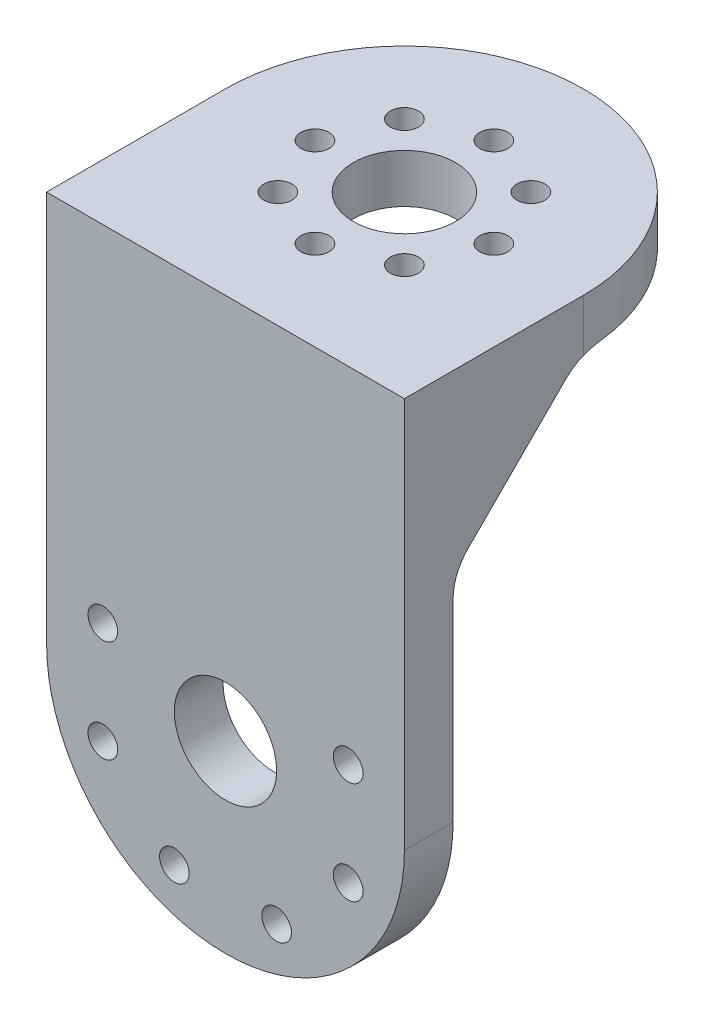
from build123d import *

# Parameters (mm, degrees)
SKETCH1_W                      = 70
SKETCH1_H                      = 70
BOSS_EXTRUDE1_DEPTH            = 9.525
CBORE_FOR_M5_SBHCS1_AT_2_COUNT = 2
CBORE_FOR_M5_SBHCS1_AT_2_PITCH = 13.393920133
CBORE_FOR_M5_SBHCS1_AT_3_COUNT = 2
CBORE_FOR_M5_SBHCS1_AT_3_PITCH = 24.748737342
CBORE_FOR_M5_SBHCS1_AT_4_COUNT = 2
CBORE_FOR_M5_SBHCS1_AT_4_PITCH = 32.335783638
CBORE_FOR_M5_SBHCS1_AT_5_COUNT = 2
CBORE_FOR_M5_SBHCS1_AT_5_PITCH = 35
CBORE_FOR_M5_SBHCS1_AT_6_COUNT = 2
CBORE_FOR_M5_SBHCS1_AT_6_PITCH = 32.335783638
CBORE_FOR_M5_SBHCS1_AT_7_COUNT = 2
CBORE_FOR_M5_SBHCS1_AT_7_PITCH = 24.748737342
CBORE_FOR_M5_SBHCS1_AT_8_COUNT = 2
CBORE_FOR_M5_SBHCS1_AT_8_PITCH = 13.393920133
SKETCH5_R                      = 10
CUT_EXTRUDE1_DEPTH             = 51.405611047
SKETCH6_W                      = 70
SKETCH6_H                      = 102
BOSS_EXTRUDE2_DEPTH            = 9.525
CBORE_FOR_M5_SHCS1_D           = 5.8
CBORE_FOR_M5_SHCS1_CBORE_D     = 10
CBORE_FOR_M5_SHCS1_CBORE_DEPTH = 5
SKETCH7_R                      = 10
CUT_EXTRUDE3_DEPTH             = 9.525
BOSS_EXTRUDE3_DEPTH            = 8
FILLET1_R                      = 10
FILLET1_OF_MIRROR1_R           = 10
FILLET2_R                      = 35


with BuildPart() as part:
    # Sketch1 → Boss-Extrude1 (new body)
    with BuildSketch(Plane(origin=(0, 0, 0), x_dir=(1, 0, 0), z_dir=(0, 1, 0))):
        Rectangle(SKETCH1_W, SKETCH1_H)
    extrude(amount=BOSS_EXTRUDE1_DEPTH)

    # Sketch4 → CBORE for M5 SBHCS1 (revolve, cut)
    with BuildSketch(Plane(origin=(17.5, 0, 0), x_dir=(0, 0, -1), z_dir=(1, 0, 0))):
        Polygon((0, 0), (0, 9.525), (2.75, 9.525), (2.75, 2.75), (5.25, 2.75), (5.25, 0.025), (5.275, 0), align=None)
    cbore_for_m5_sbhcs1 = revolve(axis=Axis((17.5, -6.35, 0), (0, 1, 0)), mode=Mode.SUBTRACT)

    # CBORE for M5 SBHCS1 at 2: CBORE for M5 SBHCS1 ×2
    with Locations(*[Vector(-0.3826834323650897, 0, -0.9238795325112868) * (i * CBORE_FOR_M5_SBHCS1_AT_2_PITCH) for i in range(1, CBORE_FOR_M5_SBHCS1_AT_2_COUNT)]):
        add(cbore_for_m5_sbhcs1, mode=Mode.SUBTRACT)

    # CBORE for M5 SBHCS1 at 3: CBORE for M5 SBHCS1 ×2
    with Locations(*[Vector(-0.7071067811865476, 0, -0.7071067811865476) * (i * CBORE_FOR_M5_SBHCS1_AT_3_PITCH) for i in range(1, CBORE_FOR_M5_SBHCS1_AT_3_COUNT)]):
        add(cbore_for_m5_sbhcs1, mode=Mode.SUBTRACT)

    # CBORE for M5 SBHCS1 at 4: CBORE for M5 SBHCS1 ×2
    with Locations(*[Vector(-0.9238795325112867, 0, -0.38268343236508984) * (i * CBORE_FOR_M5_SBHCS1_AT_4_PITCH) for i in range(1, CBORE_FOR_M5_SBHCS1_AT_4_COUNT)]):
        add(cbore_for_m5_sbhcs1, mode=Mode.SUBTRACT)

    # CBORE for M5 SBHCS1 at 5: CBORE for M5 SBHCS1 ×2
    with Locations(*[(-i * CBORE_FOR_M5_SBHCS1_AT_5_PITCH, 0, 0) for i in range(1, CBORE_FOR_M5_SBHCS1_AT_5_COUNT)]):
        add(cbore_for_m5_sbhcs1, mode=Mode.SUBTRACT)

    # CBORE for M5 SBHCS1 at 6: CBORE for M5 SBHCS1 ×2
    with Locations(*[Vector(-0.9238795325112868, 0, 0.38268343236508967) * (i * CBORE_FOR_M5_SBHCS1_AT_6_PITCH) for i in range(1, CBORE_FOR_M5_SBHCS1_AT_6_COUNT)]):
        add(cbore_for_m5_sbhcs1, mode=Mode.SUBTRACT)

    # CBORE for M5 SBHCS1 at 7: CBORE for M5 SBHCS1 ×2
    with Locations(*[Vector(-0.7071067811865477, 0, 0.7071067811865475) * (i * CBORE_FOR_M5_SBHCS1_AT_7_PITCH) for i in range(1, CBORE_FOR_M5_SBHCS1_AT_7_COUNT)]):
        add(cbore_for_m5_sbhcs1, mode=Mode.SUBTRACT)

    # CBORE for M5 SBHCS1 at 8: CBORE for M5 SBHCS1 ×2
    with Locations(*[Vector(-0.3826834323650897, 0, 0.9238795325112868) * (i * CBORE_FOR_M5_SBHCS1_AT_8_PITCH) for i in range(1, CBORE_FOR_M5_SBHCS1_AT_8_COUNT)]):
        add(cbore_for_m5_sbhcs1, mode=Mode.SUBTRACT)

    # Sketch5 → Cut-Extrude1 (cut, through all)
    with BuildSketch(Plane.XZ):
        with Locations(Location((0, 0, 0), (0, 0, 270))):
            Circle(SKETCH5_R)
    extrude(amount=-CUT_EXTRUDE1_DEPTH, mode=Mode.SUBTRACT)

    # Sketch6 → Boss-Extrude2 (add)
    with BuildSketch(Plane.XY.offset(35)):
        with Locations((0, -51)):
            Rectangle(SKETCH6_W, SKETCH6_H)
    extrude(amount=-BOSS_EXTRUDE2_DEPTH)

    # CBORE for M5 SHCS1 (through all)
    with Locations(Plane(origin=(0, 0, 25.475), x_dir=(-1, 0, 0), z_dir=(0, 0, -1))):
        with Locations((-24, -58), (-24, -78), (-10, -92), (10, -92), (24, -78), (24, -58)):
            CounterBoreHole(CBORE_FOR_M5_SHCS1_D / 2, CBORE_FOR_M5_SHCS1_CBORE_D / 2, CBORE_FOR_M5_SHCS1_CBORE_DEPTH)

    # Sketch7 → Cut-Extrude3 (cut)
    with BuildSketch(Plane(origin=(0, 0, 25.475), x_dir=(-1, 0, 0), z_dir=(0, 0, -1))):
        with Locations((0, -66)):
            Circle(SKETCH7_R)
    extrude(amount=-CUT_EXTRUDE3_DEPTH, mode=Mode.SUBTRACT)

    # Sketch17 → Boss-Extrude3 (add)
    with BuildSketch(Plane.ZY.offset(35)):
        Polygon((25.475, 0), (25.475, -25), (0.475, 0), align=None)
    boss_extrude3 = extrude(amount=-BOSS_EXTRUDE3_DEPTH)

    # Fillet1
    fillet1_edges = [part.edges().sort_by_distance(p)[0] for p in [
        (-31, 0, 0.475),
        (-31, -25, 25.475),
    ]]
    fillet(fillet1_edges, radius=FILLET1_R)

    # Mirror1: Boss-Extrude3 across plane
    add(boss_extrude3.mirror(Plane(origin=(0, 0, 0), x_dir=(0, 0, 1), z_dir=(1, 0, 0))))

    # Fillet1 of Mirror1
    fillet1_of_mirror1_edges = [part.edges().sort_by_distance(p)[0] for p in [
        (31, 0, 0.475),
        (31, -25, 25.475),
    ]]
    fillet(fillet1_of_mirror1_edges, radius=FILLET1_OF_MIRROR1_R)

    # Fillet2
    fillet2_edges = [part.edges().sort_by_distance(p)[0] for p in [
        (-35, 4.7625, -35),
        (35, 4.7625, -35),
        (35, -102, 30.2375),
        (-35, -102, 30.2375),
    ]]
    fillet(fillet2_edges, radius=FILLET2_R - 0.0001)  # a hair under: the kernel refuses the full size


solid = part.part
